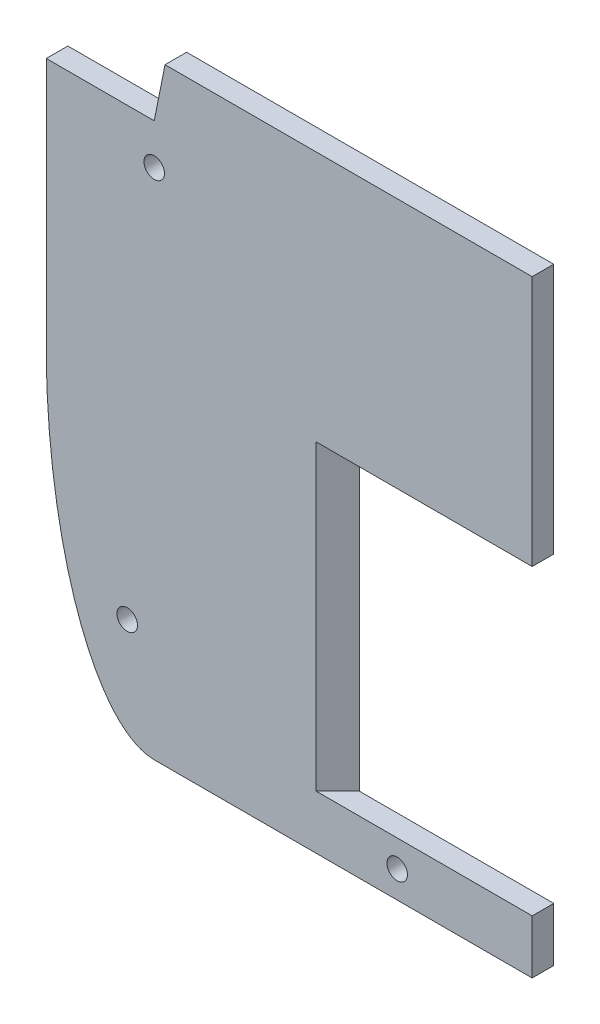
from build123d import *

# Parameters (mm, degrees)
SKETCH2_W                      = 114.3
SKETCH2_H                      = 142.875
BOSS_EXTRUDE2_DEPTH            = 30.48
FILLET1_SIZE                   = 25.4
FILLET1_SIZE_2                 = 71.501
BOSS_EXTRUDE3_DEPTH            = 11.43
CUT_EXTRUDE2_DEPTH             = 25.4
FILLET2_R                      = 1.27
SKETCH7_W                      = 27.94
SKETCH7_H                      = 30.48
CUT_EXTRUDE4_DEPTH             = 12.7
BOSS_EXTRUDE4_DEPTH            = 11.43
CUT_EXTRUDE6_DEPTH             = 25.4
CUT_EXTRUDE7_DEPTH             = 171.262283535
CUT_EXTRUDE7_DEPTH_BACK        = 171.262283535
SKETCH11_R                     = 3.175
CUT_EXTRUDE8_REACH             = 185.225
SKETCH12_R                     = 3.175
CUT_EXTRUDE8_DIRECTION_2_DEPTH = 184.224735996
CHAMFER1_SIZE2                 = 12.7
CHAMFER1_SIZE                  = 2.54
SKETCH13_W                     = 7.62
SKETCH13_H                     = 5.08
CUT_EXTRUDE9_DEPTH             = 25.4
FILLET4_R                      = 1.27
CUT_EXTRUDE10_DEPTH            = 195.431359314
CHAMFER2_SIZE                  = 12.7
CUT_EXTRUDE11_REACH            = 196.431
SKETCH15_R                     = 3.175
BOSS_EXTRUDE5_DEPTH            = 1.27
CHAMFER3_SIZE                  = 1.27
BOSS_EXTRUDE6_DEPTH            = 1.27
CHAMFER4_SIZE                  = 1.27
FILLET5_R                      = 15.24
CUT_EXTRUDE12_DEPTH            = 16.51
SKETCH20_W                     = 2.54
SKETCH20_H                     = 2.54
CUT_EXTRUDE13_DEPTH            = 171.777226453
FILLET6_R                      = 1.27
CUT_EXTRUDE14_DEPTH            = 1.27
CUT_EXTRUDE14_DEPTH_BACK       = 1.27
SKETCH21_W                     = 5.08
SKETCH21_H                     = 33.02
SKETCH21_H_2                   = 10.329873089
SKETCH21_H_3                   = 10.221702335
SKETCH21_W_2                   = 7.62
SKETCH21_H_4                   = 1.402013576
SKETCH21_W_3                   = 1.485233779
FILLET7_R                      = 11.43
SKETCH22_R                     = 1.27
CUT_EXTRUDE15_DEPTH            = 12.7
SKETCH24_W                     = 120.524481761
SKETCH24_H                     = 158.415517923
CUT_EXTRUDE17_DEPTH            = 25.4
SKETCH25_W                     = 45.72
SKETCH25_H                     = 71.15970777
CUT_EXTRUDE18_DEPTH            = 184.039782773
CHAMFER5_SIZE                  = 5.08
SKETCH27_R                     = 2.413
CUT_EXTRUDE20_DEPTH            = 184.039782773


# Some blends are built 0.0001 mm under size
with BuildPart() as part:
    # Sketch2 → Boss-Extrude2 (new body)
    with BuildSketch(Plane.XY):
        with Locations((57.15, 71.4375)):
            Rectangle(SKETCH2_W, SKETCH2_H)
    extrude(amount=BOSS_EXTRUDE2_DEPTH)

    # Fillet1
    # an asymmetric fillet: 71.501, 25.4 mm, written as the material it takes off along each edge
    with BuildSketch(Plane(origin=(0, 0, -178.7525), x_dir=(1, 0, 0), z_dir=(0, 0, 1))) as fillet1_piece_1:
        with BuildLine():
            Bezier((FILLET1_SIZE, 0), (0, 0), (0, FILLET1_SIZE_2), weights=[1, 0.707106781, 1])
            Line((0, FILLET1_SIZE_2), (0, 0))
            Line((0, 0), (FILLET1_SIZE, 0))
        make_face()
    extrude(amount=387.985, mode=Mode.SUBTRACT)

    # Sketch3 → Boss-Extrude3 (add)
    with BuildSketch(Plane(origin=(0, 142.875, 0), x_dir=(1, 0, 0), z_dir=(0, 1, 0))):
        with BuildLine():
            Line((33.866582, -7.62), (33.866582, -27.94))
            ThreePointArc((33.866582, -27.94), (28.786582, -17.78), (33.866582, -7.62))
        make_face()
        with BuildLine():
            Line((49.106582, -7.62), (49.106582, -27.94))
            ThreePointArc((49.106582, -27.94), (54.186582, -17.78), (49.106582, -7.62))
        make_face()
    extrude(amount=BOSS_EXTRUDE3_DEPTH)

    # Sketch5 → Cut-Extrude2 (cut)
    with BuildSketch(Plane.XY.offset(30.48)):
        with BuildLine():
            Line((62.653333333, 142.875), (77.893333333, 142.875))
            ThreePointArc((77.893333333, 142.875), (70.273333333, 119.729689625), (62.653333333, 142.875))
        make_face()
        with BuildLine():
            Line((91.44, 142.875), (106.68, 142.875))
            ThreePointArc((106.68, 142.875), (99.06, 119.729689625), (91.44, 142.875))
        make_face()
    extrude(amount=-CUT_EXTRUDE2_DEPTH, mode=Mode.SUBTRACT)

    # Fillet2
    fillet2_edges = [part.edges().sort_by_distance(p)[0] for p in [
        (77.893333333, 142.875, 17.78),
        (62.653333333, 142.875, 17.78),
        (91.44, 142.875, 17.78),
    ]]
    fillet(fillet2_edges, radius=FILLET2_R)

    # Sketch7 → Cut-Extrude4 (cut)
    with BuildSketch(Plane(origin=(0, 142.875, 0), x_dir=(1, 0, 0), z_dir=(0, 1, 0))):
        with Locations((13.97, -15.24)):
            Rectangle(SKETCH7_W, SKETCH7_H)
    extrude(amount=-CUT_EXTRUDE4_DEPTH, mode=Mode.SUBTRACT)

    # Sketch8 → Boss-Extrude4 (add)
    with BuildSketch(Plane(origin=(0, 130.175, 0), x_dir=(1, 0, 0), z_dir=(0, 1, 0))):
        with BuildLine():
            Line((5.08, -7.62), (5.08, -27.94))
            ThreePointArc((5.08, -27.94), (0, -17.78), (5.08, -7.62))
        make_face()
        with BuildLine():
            Line((20.32, -7.62), (20.32, -27.94))
            ThreePointArc((20.32, -27.94), (25.4, -17.78), (20.32, -7.62))
        make_face()
    extrude(amount=BOSS_EXTRUDE4_DEPTH)

    # Sketch10 → Cut-Extrude6 (cut)
    with BuildSketch(Plane.XY.offset(30.48)):
        Polygon((63.5, 109.855), (12.7, 109.855), (12.7, 61.2775), (38.1, 12.7), (63.5, 12.7), (63.5, 94.615), (106.68, 94.615), (106.68, 109.855), align=None)
    extrude(amount=-CUT_EXTRUDE6_DEPTH, mode=Mode.SUBTRACT)

    # Sketch11 → Cut-Extrude7 (cut, two sides: drawn at the far end of the back side and taken through both)
    with BuildSketch(Plane.ZY.offset(-49.106582).offset(-CUT_EXTRUDE7_DEPTH_BACK)):
        with Locations((17.78, 149.225)):
            Circle(SKETCH11_R)
        with BuildLine():
            Line((22.044917923, 151.984868677), (27.94, 142.875))
            Line((27.94, 142.875), (27.94, 154.305))
            Line((27.94, 154.305), (17.78, 154.305))
            ThreePointArc((17.78, 154.305), (20.207577715, 153.687428312), (22.044917923, 151.984868677))
        make_face()
    extrude(amount=CUT_EXTRUDE7_DEPTH + CUT_EXTRUDE7_DEPTH_BACK, mode=Mode.SUBTRACT)

    # Cut-Extrude8: up to this face of the body (flat: up to its plane)
    cut_extrude8_end = Plane(part.part.faces().sort_by_distance((27.94, 136.525, 15.24))[0])
    # Sketch12 → Cut-Extrude8 (cut, up to the picked face)
    with BuildSketch(Plane.ZY.offset(-20.32), mode=Mode.PRIVATE) as cut_extrude8_sk1:
        with Locations((17.78, 136.525)):
            Circle(SKETCH12_R)
    cut_extrude8_tool1 = split(extrude(cut_extrude8_sk1.sketch, amount=-CUT_EXTRUDE8_REACH, mode=Mode.PRIVATE), bisect_by=cut_extrude8_end, keep=Keep.BOTH, mode=Mode.PRIVATE)
    # Sketch12 → Cut-Extrude8 (cut, up to the picked face)
    with BuildSketch(Plane.ZY.offset(-20.32), mode=Mode.PRIVATE) as cut_extrude8_sk2:
        with BuildLine():
            Line((22.044917923, 139.284868677), (27.94, 130.175))
            Line((27.94, 130.175), (27.94, 141.605))
            Line((27.94, 141.605), (17.78, 141.605))
            ThreePointArc((17.78, 141.605), (20.207577715, 140.987428312), (22.044917923, 139.284868677))
        make_face()
    cut_extrude8_tool2 = split(extrude(cut_extrude8_sk2.sketch, amount=-CUT_EXTRUDE8_REACH, mode=Mode.PRIVATE), bisect_by=cut_extrude8_end, keep=Keep.BOTH, mode=Mode.PRIVATE)
    add(cut_extrude8_tool1.solids().sort_by(Axis((20.32, 136.525, 17.78), (1, 0, 0)))[0], mode=Mode.SUBTRACT)
    add(cut_extrude8_tool2.solids().sort_by(Axis((20.32, 137.885407, 25.333291), (1, 0, 0)))[0], mode=Mode.SUBTRACT)

    # Sketch12 → Cut-Extrude8 direction 2 (cut)
    with BuildSketch(Plane.ZY.offset(-20.32)):
        with Locations((17.78, 136.525)):
            Circle(SKETCH12_R)
        with BuildLine():
            Line((22.044917923, 139.284868677), (27.94, 130.175))
            Line((27.94, 130.175), (27.94, 141.605))
            Line((27.94, 141.605), (17.78, 141.605))
            ThreePointArc((17.78, 141.605), (20.207577715, 140.987428312), (22.044917923, 139.284868677))
        make_face()
    extrude(amount=CUT_EXTRUDE8_DIRECTION_2_DEPTH, mode=Mode.SUBTRACT)

    # Chamfer1
    chamfer1_edges = [part.edges().sort_by_distance(p)[0] for p in [
        (27.94, 130.175, 15.24),
    ]]
    chamfer1_side = [part.faces().sort_by_distance(p)[0] for p in [
        (27.8892, 130.175, 15.24),
    ]]
    chamfer(chamfer1_edges, length=CHAMFER1_SIZE - 0.0001, length2=CHAMFER1_SIZE2 - 0.0001, reference=chamfer1_side[0])  # a hair under: the kernel refuses the full size

    # Sketch13 → Cut-Extrude9 (cut)
    with BuildSketch(Plane.XY.offset(30.48)):
        with Locations((110.49, 140.335)):
            Rectangle(SKETCH13_W, SKETCH13_H)
    extrude(amount=-CUT_EXTRUDE9_DEPTH, mode=Mode.SUBTRACT)

    # Fillet4
    fillet4_edges = [part.edges().sort_by_distance(p)[0] for p in [
        (110.768630723, 137.795, 17.78),
        (114.3, 137.795, 17.78),
    ]]
    fillet(fillet4_edges, radius=FILLET4_R)

    # Sketch14 → Cut-Extrude10 (cut, through all)
    with BuildSketch(Plane.XY.offset(30.48)):
        Polygon((114.3, 12.7), (81.28, 12.7), (81.28, 26.67), (111.76, 26.67), (111.76, 69.85), (81.28, 69.85), (81.28, 83.82), (114.3, 83.82), align=None)
    extrude(amount=-CUT_EXTRUDE10_DEPTH, mode=Mode.SUBTRACT)

    # Chamfer2
    chamfer2_edges = [part.edges().sort_by_distance(p)[0] for p in [
        (81.28, 76.835, 30.48),
        (81.28, 19.685, 30.48),
    ]]
    chamfer(chamfer2_edges, length=CHAMFER2_SIZE)

    # Cut-Extrude11: up to this face of the body (flat: up to its plane)
    cut_extrude11_end = Plane(part.part.faces().sort_by_distance((59.69, 109.855, 17.78))[0])
    # Sketch15 → Cut-Extrude11 (cut, up to the picked face)
    with BuildSketch(Plane.XZ, mode=Mode.PRIVATE) as cut_extrude11_sk1:
        with Locations(Location((99.06, 17.78, 0), (0, 0, 270))):
            Circle(SKETCH15_R)
    cut_extrude11_tool1 = split(extrude(cut_extrude11_sk1.sketch, amount=-CUT_EXTRUDE11_REACH, mode=Mode.PRIVATE), bisect_by=cut_extrude11_end, keep=Keep.BOTH, mode=Mode.PRIVATE)
    add(cut_extrude11_tool1.solids().sort_by(Axis((99.06, 0, 17.78), (0, 1, 0)))[0], mode=Mode.SUBTRACT)

    # Sketch16 → Boss-Extrude5 (add)
    with BuildSketch(Plane(origin=(0, 141.605, 0), x_dir=(1, 0, 0), z_dir=(0, 1, 0))):
        with BuildLine():
            Line((0.406992957, -14.590646171), (5.08, -14.605))
            Line((5.08, -14.605), (5.08, -7.62))
            ThreePointArc((5.08, -7.62), (2.151092977, -10.708185479), (0.406992957, -14.590646171))
        make_face()
        with BuildLine():
            Line((20.32, -14.605), (24.996722124, -14.605))
            ThreePointArc((24.996722124, -14.605), (23.253033275, -10.714344425), (20.32, -7.62))
            Line((20.32, -7.62), (20.32, -14.605))
        make_face()
    extrude(amount=BOSS_EXTRUDE5_DEPTH)

    # Chamfer3
    chamfer3_edges = [part.edges().sort_by_distance(p)[0] for p in [
        (22.658361062, 142.875, 14.605),
        (2.743496479, 142.875, 14.597823086),
    ]]
    chamfer(chamfer3_edges, length=CHAMFER3_SIZE - 0.0001)  # a hair under: the kernel refuses the full size

    # Sketch17 → Boss-Extrude6 (add)
    with BuildSketch(Plane(origin=(0, 154.305, 0), x_dir=(1, 0, 0), z_dir=(0, 1, 0))):
        with BuildLine():
            Line((29.150536334, -14.761394806), (33.866582, -14.761394806))
            Line((33.866582, -14.761394806), (33.866582, -7.62))
            ThreePointArc((33.866582, -7.62), (30.888902084, -10.781487273), (29.150536334, -14.761394806))
        make_face()
        with BuildLine():
            Line((49.106582, -14.761394806), (53.822627666, -14.761394806))
            ThreePointArc((53.822627666, -14.761394806), (52.084261916, -10.781487273), (49.106582, -7.62))
            Line((49.106582, -7.62), (49.106582, -14.761394806))
        make_face()
    extrude(amount=BOSS_EXTRUDE6_DEPTH)

    # Chamfer4
    chamfer4_edges = [part.edges().sort_by_distance(p)[0] for p in [
        (51.464604833, 155.575, 14.761394806),
        (31.508559167, 155.575, 14.761394806),
    ]]
    chamfer(chamfer4_edges, length=CHAMFER4_SIZE - 0.0001)  # a hair under: the kernel refuses the full size

    # Fillet5
    fillet5_edges = [part.edges().sort_by_distance(p)[0] for p in [
        (111.76, 48.26, 30.48),
    ]]
    fillet(fillet5_edges, radius=FILLET5_R)

    # Sketch19 → Cut-Extrude12 (cut)
    with BuildSketch(Plane.XY.offset(30.48)):
        Polygon((81.28, 52.07), (111.76, 52.07), (111.76, 57.15), (81.28, 57.15), (69.85, 57.15), (69.85, 52.07), align=None)
    extrude(amount=-CUT_EXTRUDE12_DEPTH, mode=Mode.SUBTRACT)

    # Sketch20 → Cut-Extrude13 (cut, through all)
    with BuildSketch(Plane.ZY.offset(-63.5)):
        with Locations((19.05, 39.37)):
            Rectangle(SKETCH20_W, SKETCH20_H)
    extrude(amount=-CUT_EXTRUDE13_DEPTH, mode=Mode.SUBTRACT)

    # Fillet6
    fillet6_edges = [part.edges().sort_by_distance(p)[0] for p in [
        (63.5, 38.1, 19.05),
    ]]
    fillet(fillet6_edges, radius=FILLET6_R)

    # Sketch21 → Cut-Extrude14 (cut, two sides: drawn at the far end of the back side and taken through both)
    with BuildSketch(Plane.XY.offset(17.78).offset(-CUT_EXTRUDE14_DEPTH_BACK)):
        Polygon((12.7, 109.855), (10.485930724, 130.175), (15.565930724, 130.175), (17.78, 109.855), align=None)
        Polygon((55.429725371, 142.875), (50.86041281, 121.653709764), (50.86041281, 109.855), (52.449738918, 109.855), (52.449738918, 121.653709764), (57.019051479, 142.875), align=None)
        with Locations((41.486582, 126.365)):
            Rectangle(SKETCH21_W, SKETCH21_H)
        with Locations((69.426582, 115.019936545)):
            Rectangle(SKETCH21_W, SKETCH21_H_2)
        with Locations((98.636582, 114.965851168)):
            Rectangle(SKETCH21_W, SKETCH21_H_3)
        with Locations((110.49, 102.445426643)):
            Rectangle(SKETCH21_W_2, SKETCH21_H_4)
        with Locations((84.636338767, 126.365)):
            Rectangle(SKETCH21_W_3, SKETCH21_H)
    extrude(amount=CUT_EXTRUDE14_DEPTH + CUT_EXTRUDE14_DEPTH_BACK, mode=Mode.SUBTRACT)

    # Fillet7
    fillet7_edges = [part.edges().sort_by_distance(p)[0] for p in [
        (63.5, 94.615, 17.78),
    ]]
    fillet(fillet7_edges, radius=FILLET7_R)

    # Sketch22 → Cut-Extrude15 (cut)
    with BuildSketch(Plane(origin=(0, 12.7, 0), x_dir=(1, 0, 0), z_dir=(0, 1, 0))):
        with Locations(Location((43.18, -11.908276952, 0), (0, 0, 180))):
            Circle(SKETCH22_R)
        with Locations(Location((48.26, -11.908276952, 0), (0, 0, 180))):
            Circle(SKETCH22_R)
        with Locations(Location((53.34, -11.908276952, 0), (0, 0, 180))):
            Circle(SKETCH22_R)
        with Locations(Location((58.42, -11.908276952, 0), (0, 0, 180))):
            Circle(SKETCH22_R)
        with Locations(Location((43.18, -22.068276952, 0), (0, 0, 180))):
            Circle(SKETCH22_R)
        with Locations(Location((48.26, -22.068276952, 0), (0, 0, 180))):
            Circle(SKETCH22_R)
        with Locations(Location((53.34, -22.068276952, 0), (0, 0, 180))):
            Circle(SKETCH22_R)
        with Locations(Location((58.42, -22.068276952, 0), (0, 0, 180))):
            Circle(SKETCH22_R)
    extrude(amount=-CUT_EXTRUDE15_DEPTH, mode=Mode.SUBTRACT)

    # Sketch24 → Cut-Extrude17 (cut)
    with BuildSketch(Plane.XY.offset(30.48)):
        with Locations((54.03775912, 79.207758962)):
            Rectangle(SKETCH24_W, SKETCH24_H)
    extrude(amount=-CUT_EXTRUDE17_DEPTH, mode=Mode.SUBTRACT)

    # Sketch25 → Cut-Extrude18 (cut, through all)
    with BuildSketch(Plane.XY.offset(5.08)):
        with Locations((91.44, 48.240146115)):
            Rectangle(SKETCH25_W, SKETCH25_H)
    extrude(amount=-CUT_EXTRUDE18_DEPTH, mode=Mode.SUBTRACT)

    # Chamfer5
    chamfer5_edges = [part.edges().sort_by_distance(p)[0] for p in [
        (68.58, 48.240146115, 5.08),
    ]]
    chamfer(chamfer5_edges, length=CHAMFER5_SIZE - 0.0001)  # a hair under: the kernel refuses the full size

    # Sketch27 → Cut-Extrude20 (cut, through all)
    with BuildSketch(Plane.XY.offset(5.08)):
        with Locations((25.4, 120.65)):
            Circle(SKETCH27_R)
        with Locations((19.05, 25.4)):
            Circle(SKETCH27_R)
        with Locations((82.55, 6.35)):
            Circle(SKETCH27_R)
    extrude(amount=-CUT_EXTRUDE20_DEPTH, mode=Mode.SUBTRACT)


solid = part.part
